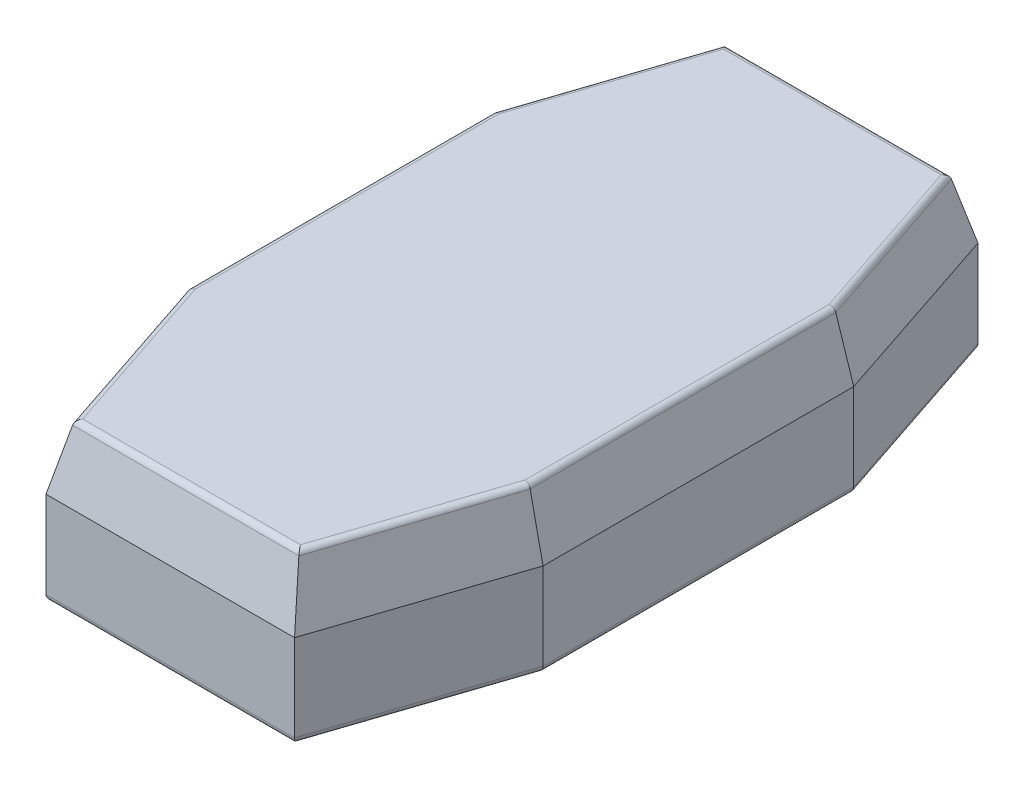
from build123d import *

# Parameters (mm, degrees)
BOSS_EXTRUDE1_DEPTH = 2.54
BOSS_EXTRUDE1_TAPER = 15
BOSS_EXTRUDE2_DEPTH = 3.8
FILLET2_R           = 0.1
CHAMFER1_SIZE       = 0.2
BOSS_EXTRUDE3_DEPTH = 3.8
FILLET3_R           = 0.25
FILLET5_R           = 0.5
FILLET6_R           = 0.1
FILLET7_R           = 0.25


with BuildPart() as part:
    # Sketch1 → Boss-Extrude1 (new body)
    with BuildSketch(Plane(origin=(0, 0, 0), x_dir=(1, 0, 0), z_dir=(0, 1, 0))):
        Polygon((-7.62, 6.35), (-7.62, -6.35), (-5.08, -13.97), (5.08, -13.97), (7.62, -6.35), (7.62, 6.35), (5.08, 13.97), (-5.08, 13.97), align=None)
    extrude(amount=BOSS_EXTRUDE1_DEPTH, taper=BOSS_EXTRUDE1_TAPER)

    # Stem → Boss-Extrude2 (add)
    with BuildSketch(Plane.XZ):
        with BuildLine():
            Line((2.499999969, 2.374999949), (-2.499999969, 2.374999949))
            ThreePointArc((-2.499999969, 2.374999949), (-2.85355336, 2.22855334), (-2.999999969, 1.874999949))
            Line((-2.999999969, 1.874999949), (-2.999999969, -1.874999949))
            ThreePointArc((-2.999999969, -1.874999949), (-2.85355336, -2.22855334), (-2.499999969, -2.374999949))
            Line((-2.499999969, -2.374999949), (2.499999969, -2.374999949))
            ThreePointArc((2.499999969, -2.374999949), (2.85355336, -2.22855334), (2.999999969, -1.874999949))
            Line((2.999999969, -1.874999949), (2.999999969, 1.874999949))
            ThreePointArc((2.999999969, 1.874999949), (2.85355336, 2.22855334), (2.499999969, 2.374999949))
        make_face()
        Polygon((-0.5625, 0.6625), (-0.5625, 2.075), (0.5625, 2.075), (0.5625, 0.6625), (2.0625, 0.6625), (2.0625, -0.6625), (0.5625, -0.6625), (0.5625, -2.075), (-0.5625, -2.075), (-0.5625, -0.6625), (-2.0625, -0.6625), (-2.0625, 0.6625), align=None, mode=Mode.SUBTRACT)
    extrude(amount=BOSS_EXTRUDE2_DEPTH)

    # Fillet2
    fillet2_edges = [part.edges().sort_by_distance(p)[0] for p in [
        (2.85355336, -3.8, 2.22855334),
        (0, -3.8, 2.374999949),
        (2.999999969, -3.8, 0),
        (-2.85355336, -3.8, 2.22855334),
        (-2.999999969, -3.8, 0),
        (-2.85355336, -3.8, -2.22855334),
        (0, -3.8, -2.374999949),
        (2.85355336, -3.8, -2.22855334),
    ]]
    fillet(fillet2_edges, radius=FILLET2_R)

    # Chamfer1
    chamfer1_edges = [part.edges().sort_by_distance(p)[0] for p in [
        (-2.0625, -3.8, 0),
        (-1.3125, -3.8, 0.6625),
        (-0.5625, -3.8, 1.36875),
        (1.3125, -3.8, 0.6625),
        (-0.5625, -3.8, -1.36875),
        (0, -3.8, 2.075),
        (0.5625, -3.8, 1.36875),
        (2.0625, -3.8, 0),
        (1.3125, -3.8, -0.6625),
        (0.5625, -3.8, -1.36875),
        (-1.3125, -3.8, -0.6625),
    ]]
    chamfer(chamfer1_edges, length=CHAMFER1_SIZE - 0.0001)  # a hair under: the kernel refuses the full size

    # Sketch3 → Boss-Extrude3 (add)
    with BuildSketch(Plane.XZ):
        Polygon((-7.62, 6.35), (-7.62, -6.35), (-5.08, -13.97), (5.08, -13.97), (7.62, -6.35), (7.62, 6.35), (5.08, 13.97), (-5.08, 13.97), align=None)
        Polygon((-6.35, -6.143907372), (-4.164635791, -12.7), (4.164635791, -12.7), (6.35, -6.143907372), (6.35, 6.143907372), (4.164635791, 12.7), (-4.164635791, 12.7), (-6.35, 6.143907372), align=None, mode=Mode.SUBTRACT)
    extrude(amount=BOSS_EXTRUDE3_DEPTH)

    # Fillet3
    fillet3_edges = [part.edges().sort_by_distance(p)[0] for p in [
        (-6.35, -3.8, 10.16),
        (-7.62, -3.8, 0),
        (-6.35, -3.8, -10.16),
        (0, -3.8, -13.97),
        (6.35, -3.8, -10.16),
        (7.62, -3.8, 0),
        (6.35, -3.8, 10.16),
        (0, -3.8, 13.97),
        (-6.35, -3.8, 0),
        (-5.257317895, -3.8, -9.421953686),
        (0, -3.8, -12.7),
        (5.257317895, -3.8, -9.421953686),
        (6.35, -3.8, 0),
        (5.257317895, -3.8, 9.421953686),
        (0, -3.8, 12.7),
        (-5.257317895, -3.8, 9.421953686),
    ]]
    fillet(fillet3_edges, radius=FILLET3_R)

    # Fillet5
    fillet5_edges = [part.edges().sort_by_distance(p)[0] for p in [
        (-6.35, 0, 0),
        (-5.257317895, 0, -9.421953686),
        (0, 0, -12.7),
        (5.257317895, 0, -9.421953686),
        (6.35, 0, 0),
        (5.257317895, 0, 9.421953686),
        (0, 0, 12.7),
        (-5.257317895, 0, 9.421953686),
        (-2.85355336, 0, 2.22855334),
        (-2.999999969, 0, 0),
        (-2.85355336, 0, -2.22855334),
        (0, 0, -2.374999949),
        (2.85355336, 0, -2.22855334),
        (2.85355336, 0, 2.22855334),
        (2.999999969, 0, 0),
        (0, 0, 2.374999949),
    ]]
    fillet(fillet5_edges, radius=FILLET5_R)

    # Fillet6
    fillet6_edges = [part.edges().sort_by_distance(p)[0] for p in [
        (0, 0, 2.075),
        (0.5625, 0, 1.36875),
        (2.0625, 0, 0),
        (1.3125, 0, -0.6625),
        (0.5625, 0, -1.36875),
        (-1.3125, 0, -0.6625),
        (-2.0625, 0, 0),
        (-0.5625, 0, -1.36875),
        (0, 0, -2.075),
        (1.3125, 0, 0.6625),
        (-0.5625, 0, 1.36875),
        (-1.3125, 0, 0.6625),
    ]]
    fillet(fillet6_edges, radius=FILLET6_R)

    # Fillet7
    fillet7_edges = [part.edges().sort_by_distance(p)[0] for p in [
        (-6.939409051, 2.54, 0),
        (-5.764433425, 2.54, 9.764482172),
        (0, 2.54, 13.289409051),
        (5.764433425, 2.54, 9.764482172),
        (6.939409051, 2.54, 0),
        (5.764433425, 2.54, -9.764482172),
        (0, 2.54, -13.289409051),
        (-5.764433425, 2.54, -9.764482172),
    ]]
    fillet(fillet7_edges, radius=FILLET7_R)


solid = part.part
